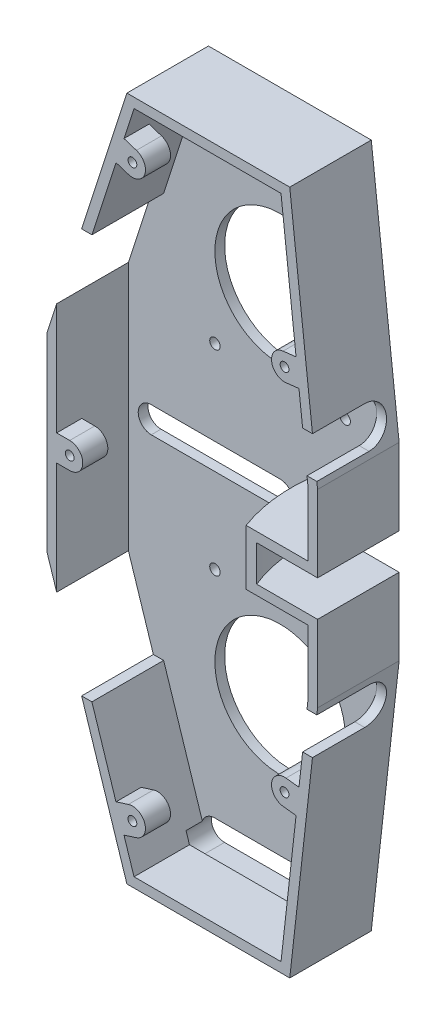
from build123d import *

# Parameters (mm, degrees)
EXTRUDE1_DEPTH          = 40
CHAMFER1_SIZE           = 20
CHAMFER1_SIZE2          = 11.547005384
CUT_EXTRUDE1_DEPTH      = 3
CUT_EXTRUDE1_DEPTH_BACK = 8
SKETCH4_R               = 45
SHELL2_T                = -3
SKETCH6_W               = 125.382075166
SKETCH6_H               = 262.961923039
CUT_EXTRUDE3_DEPTH      = 15
SKETCH7_W               = 55
SKETCH7_H               = 124
CUT_EXTRUDE4_DEPTH      = 22
CUT_EXTRUDE5_DEPTH      = 5
CUT_EXTRUDE5_DEPTH_BACK = 12
SKETCH8_R               = 20
SKETCH8_R_2             = 1.6
CUT_EXTRUDE6_DEPTH      = 10
SKETCH10_R              = 1.35
EXTRUDE2_DEPTH          = 10
CHAMFER2_SIZE           = 2.309401077
CHAMFER2_SIZE_2         = 4


with BuildPart() as part:
    # Sketch2 → Extrude1 (new body)
    with BuildSketch(Plane.XY):
        Polygon((24.967783135, -105), (33.5, -29), (33.5, 29), (24.967783135, 105), (-24.967783135, 105), (-49.5, 29), (-49.5, -29), (-24.967783135, -105), align=None)
    extrude(amount=EXTRUDE1_DEPTH)

    # Chamfer1
    chamfer1_edges = [part.edges().sort_by_distance(p)[0] for p in [
        (0, -105, 40),
        (29.233891568, -67, 40),
        (33.5, 0, 40),
        (29.233891568, 67, 40),
        (0, 105, 40),
        (-37.233891568, 67, 40),
        (-49.5, 0, 40),
        (-37.233891568, -67, 40),
    ]]
    chamfer1_side = [part.faces().sort_by_distance(p)[0] for p in [
        (-5.515477183, 0, 40),
    ]]
    chamfer(chamfer1_edges, length=CHAMFER1_SIZE, length2=CHAMFER1_SIZE2, reference=chamfer1_side[0])

    # Sketch4 → Cut-Extrude1 (cut, two sides: drawn at the far end of the back side and taken through both)
    with BuildSketch(Plane.XZ.offset(2.5).offset(-CUT_EXTRUDE1_DEPTH_BACK)):
        with Locations((56.5, 8)):
            Circle(SKETCH4_R)
    extrude(amount=CUT_EXTRUDE1_DEPTH + CUT_EXTRUDE1_DEPTH_BACK, mode=Mode.SUBTRACT)

    # Shell2
    shell2_openings = [part.faces().sort_by_distance(p)[0] for p in [
        (-6.280046319, 0, 40),
    ]]
    offset(amount=SHELL2_T, openings=shell2_openings, kind=Kind.INTERSECTION)

    # Sketch6 → Cut-Extrude3 (cut)
    with BuildSketch(Plane.XY.offset(40)):
        with Locations((5.510547988, -25.491958467)):
            Rectangle(SKETCH6_W, SKETCH6_H)
    extrude(amount=-CUT_EXTRUDE3_DEPTH, mode=Mode.SUBTRACT)

    # Sketch7 → Cut-Extrude4 (cut)
    with BuildSketch(Plane.XY.offset(25)):
        with Locations((-19, 0)):
            Rectangle(SKETCH7_W, SKETCH7_H)
    extrude(amount=-CUT_EXTRUDE4_DEPTH, mode=Mode.SUBTRACT)

    # Sketch8 → Cut-Extrude5 (cut, two sides: drawn at the far end of the back side and taken through both)
    with BuildSketch(Plane.XY.offset(3).offset(-CUT_EXTRUDE5_DEPTH_BACK)):
        with Locations((0, 54.5)):
            Circle(SKETCH8_R)
        with Locations((0, -54.5)):
            Circle(SKETCH8_R)
        with Locations((19.967783135, -30)):
            Circle(SKETCH8_R_2)
        with Locations((-19.967783135, -30)):
            Circle(SKETCH8_R_2)
        with Locations((19.967783135, 30)):
            Circle(SKETCH8_R_2)
        with Locations((-19.967783135, 30)):
            Circle(SKETCH8_R_2)
        with BuildLine():
            Line((-20.032216865, 104), (19.967783135, 104))
            ThreePointArc((19.967783135, 104), (23.967783135, 100), (19.967783135, 96))
            Line((19.967783135, 96), (-20.032216865, 96))
            ThreePointArc((-20.032216865, 96), (-24.032216865, 100), (-20.032216865, 104))
        make_face()
        with BuildLine():
            Line((-20.032216865, -96), (19.967783135, -96))
            ThreePointArc((19.967783135, -96), (23.967783135, -100), (19.967783135, -104))
            Line((19.967783135, -104), (-20.032216865, -104))
            ThreePointArc((-20.032216865, -104), (-24.032216865, -100), (-20.032216865, -96))
        make_face()
        with BuildLine():
            Line((-39.5, 4), (0, 4))
            ThreePointArc((0, 4), (4, 0), (0, -4))
            Line((0, -4), (-39.5, -4))
            ThreePointArc((-39.5, -4), (-43.5, 0), (-39.5, 4))
        make_face()
    extrude(amount=CUT_EXTRUDE5_DEPTH + CUT_EXTRUDE5_DEPTH_BACK, mode=Mode.SUBTRACT)

    # Sketch9 → Cut-Extrude6 (cut)
    with BuildSketch(Plane(origin=(33.5, 0, 0), x_dir=(0, 0, -1), z_dir=(1, 0, 0))):
        with BuildLine():
            Line((-25, 43), (-9, 43))
            ThreePointArc((-9, 43), (-3, 37), (-9, 31))
            Line((-9, 31), (-25, 31))
            ThreePointArc((-25, 31), (-31, 37), (-25, 43))
        make_face()
        with BuildLine():
            Line((-25, -31), (-9, -31))
            ThreePointArc((-9, -31), (-3, -37), (-9, -43))
            Line((-9, -43), (-25, -43))
            ThreePointArc((-25, -43), (-31, -37), (-25, -31))
        make_face()
    extrude(amount=-CUT_EXTRUDE6_DEPTH, mode=Mode.SUBTRACT)

    # Sketch10 → Extrude2 (add)
    # profile 1 of 5: a face of its own
    with BuildSketch(Plane.XY.offset(25)):
        with BuildLine():
            Line((-25.855592129, 92.48350258), (-28.313074008, 84.870304644))
            Line((-28.313074008, 84.870304644), (-24.50647504, 83.641563704))
            ThreePointArc((-24.50647504, 83.641563704), (-19.471135132, 86.219421733), (-22.048993161, 91.25476164))
            Line((-22.048993161, 91.25476164), (-25.855592129, 92.48350258))
        make_face()
        with Locations((-23.2777341, 87.448162672)):
            Circle(SKETCH10_R, mode=Mode.SUBTRACT)
    # profile 2 of 5: a face of its own
    with BuildSketch(Plane.XY.offset(25)):
        with BuildLine():
            Line((-46.5, 4), (-46.5, -4))
            Line((-46.5, -4), (-42.5, -4))
            ThreePointArc((-42.5, -4), (-38.5, 0), (-42.5, 4))
            Line((-42.5, 4), (-46.5, 4))
        make_face()
        with Locations((-42.5, 0)):
            Circle(SKETCH10_R, mode=Mode.SUBTRACT)
    # profile 3 of 5: a face of its own
    with BuildSketch(Plane.XY.offset(25)):
        with BuildLine():
            Line((27.793778068, -52.937571221), (23.81874958, -52.491310627))
            ThreePointArc((23.81874958, -52.491310627), (19.397460498, -56.020078522), (22.926228393, -60.441367604))
            Line((22.926228393, -60.441367604), (26.901256881, -60.887628197))
            Line((26.901256881, -60.887628197), (27.793778068, -52.937571221))
        make_face()
        with Locations(Location((23.372488986, -56.466339116, 0), (0, 0, 180))):
            Circle(SKETCH10_R, mode=Mode.SUBTRACT)
    # profile 4 of 5: a face of its own
    with BuildSketch(Plane.XY.offset(25)):
        with BuildLine():
            Line((26.901256881, 60.887628197), (27.793778068, 52.937571221))
            Line((27.793778068, 52.937571221), (23.81874958, 52.491310627))
            ThreePointArc((23.81874958, 52.491310627), (19.397460498, 56.020078522), (22.926228393, 60.441367604))
            Line((22.926228393, 60.441367604), (26.901256881, 60.887628197))
        make_face()
        with Locations((23.372488986, 56.466339116)):
            Circle(SKETCH10_R, mode=Mode.SUBTRACT)
    # profile 5 of 5: a face of its own
    with BuildSketch(Plane.XY.offset(25)):
        with BuildLine():
            Line((-28.313074008, -84.870304644), (-24.50647504, -83.641563704))
            ThreePointArc((-24.50647504, -83.641563704), (-19.471135132, -86.219421733), (-22.048993161, -91.25476164))
            Line((-22.048993161, -91.25476164), (-25.855592129, -92.48350258))
            Line((-25.855592129, -92.48350258), (-28.313074008, -84.870304644))
        make_face()
        with Locations(Location((-23.2777341, -87.448162672, 0), (0, 0, 180))):
            Circle(SKETCH10_R, mode=Mode.SUBTRACT)
    extrude(amount=-EXTRUDE2_DEPTH)

    # Chamfer2
    # the kernel refuses this chamfer: 4, 2.309401077 mm, written as the material it takes off along each edge
    with BuildSketch(Plane(origin=(22.926228393, 60.441367604, 15), x_dir=(0, 0, 1), z_dir=(0.9937571220719369, 0.11156514837215789, 0)), Plane(origin=(-22.048993161, -91.25476164, 15), x_dir=(0, 0, 1), z_dir=(-0.9516497420147145, -0.30718523487193755, 0))) as chamfer2_piece_1:
        Polygon((CHAMFER2_SIZE, 0), (0, CHAMFER2_SIZE_2), (0, 0), align=None)
    extrude(amount=4, mode=Mode.SUBTRACT)
    with BuildSketch(Plane(origin=(23.372488986, 56.466339116, 15), x_dir=(0.11156514837215781, -0.993757122071937, 0), z_dir=(0.993757122071937, 0.11156514837215781, 0))) as chamfer2_piece_2:
        Polygon((4 - CHAMFER2_SIZE_2, 0), (4, -CHAMFER2_SIZE), (4, 0), align=None)
    revolve(axis=Axis((23.372488986, 56.466339116, 15), (0, 0, -1)), revolution_arc=180, mode=Mode.SUBTRACT)
    with BuildSketch(Plane(origin=(27.793778068, 52.937571221, 15), x_dir=(-0.11156514837215799, 0.993757122071937, 0), z_dir=(-0.9937571220719369, -0.11156514837215799, 0)), Plane(origin=(-28.313074008, -84.870304644, 15), x_dir=(0.3071852348719375, -0.9516497420147145, 0), z_dir=(0.9516497420147145, 0.30718523487193755, 0))) as chamfer2_piece_3:
        Polygon((CHAMFER2_SIZE_2, 0), (0, -CHAMFER2_SIZE), (0, 0), align=None)
    extrude(amount=4, mode=Mode.SUBTRACT)
    with BuildSketch(Plane(origin=(-42.5, 4, 15), x_dir=(0, -1, 0), z_dir=(-1, 0, 0)), Plane(origin=(-22.048993161, 91.25476164, 15), x_dir=(-0.3071852348719375, -0.9516497420147145, 0), z_dir=(-0.9516497420147145, 0.30718523487193755, 0)), Plane(origin=(22.926228393, -60.441367604, 15), x_dir=(0.11156514837215789, 0.993757122071937, 0), z_dir=(0.9937571220719369, -0.11156514837215789, 0))) as chamfer2_piece_4:
        Polygon((CHAMFER2_SIZE_2, 0), (0, CHAMFER2_SIZE), (0, 0), align=None)
    extrude(amount=4, mode=Mode.SUBTRACT)
    with BuildSketch(Plane(origin=(-42.5, 0, 15), x_dir=(0, -1, 0), z_dir=(-1, 0, 0))) as chamfer2_piece_5:
        Polygon((4 - CHAMFER2_SIZE_2, 0), (4, CHAMFER2_SIZE), (4, 0), align=None)
    revolve(axis=Axis((-42.5, 0, 15), (0, 0, 1)), revolution_arc=180, mode=Mode.SUBTRACT)
    with BuildSketch(Plane(origin=(-46.5, -4, 15), x_dir=(0, 0, 1), z_dir=(1, 0, 0)), Plane(origin=(-28.313074008, 84.870304644, 15), x_dir=(0, 0, 1), z_dir=(0.9516497420147144, -0.30718523487193783, 0)), Plane(origin=(27.793778068, -52.937571221, 15), x_dir=(0, 0, 1), z_dir=(-0.9937571220719369, 0.11156514837215789, 0))) as chamfer2_piece_6:
        Polygon((CHAMFER2_SIZE, 0), (0, -CHAMFER2_SIZE_2), (0, 0), align=None)
    extrude(amount=4, mode=Mode.SUBTRACT)
    with BuildSketch(Plane(origin=(-23.2777341, 87.448162672, 15), x_dir=(-0.3071852348719437, -0.9516497420147125, 0), z_dir=(-0.9516497420147125, 0.3071852348719437, 0))) as chamfer2_piece_7:
        Polygon((4 - CHAMFER2_SIZE_2, 0), (4, CHAMFER2_SIZE), (4, 0), align=None)
    revolve(axis=Axis((-23.2777341, 87.448162672, 15), (0, 0, 1)), revolution_arc=180, mode=Mode.SUBTRACT)
    with BuildSketch(Plane(origin=(-23.2777341, -87.448162672, 15), x_dir=(-0.3071852348719429, 0.9516497420147128, 0), z_dir=(-0.9516497420147128, -0.3071852348719429, 0))) as chamfer2_piece_8:
        Polygon((4 - CHAMFER2_SIZE_2, 0), (4, -CHAMFER2_SIZE), (4, 0), align=None)
    revolve(axis=Axis((-23.2777341, -87.448162672, 15), (0, 0, -1)), revolution_arc=180, mode=Mode.SUBTRACT)
    with BuildSketch(Plane(origin=(23.372488986, -56.466339116, 15), x_dir=(0.11156514837215692, 0.993757122071937, 0), z_dir=(0.993757122071937, -0.11156514837215692, 0))) as chamfer2_piece_9:
        Polygon((4 - CHAMFER2_SIZE_2, 0), (4, CHAMFER2_SIZE), (4, 0), align=None)
    revolve(axis=Axis((23.372488986, -56.466339116, 15), (0, 0, 1)), revolution_arc=180, mode=Mode.SUBTRACT)


solid = part.part
